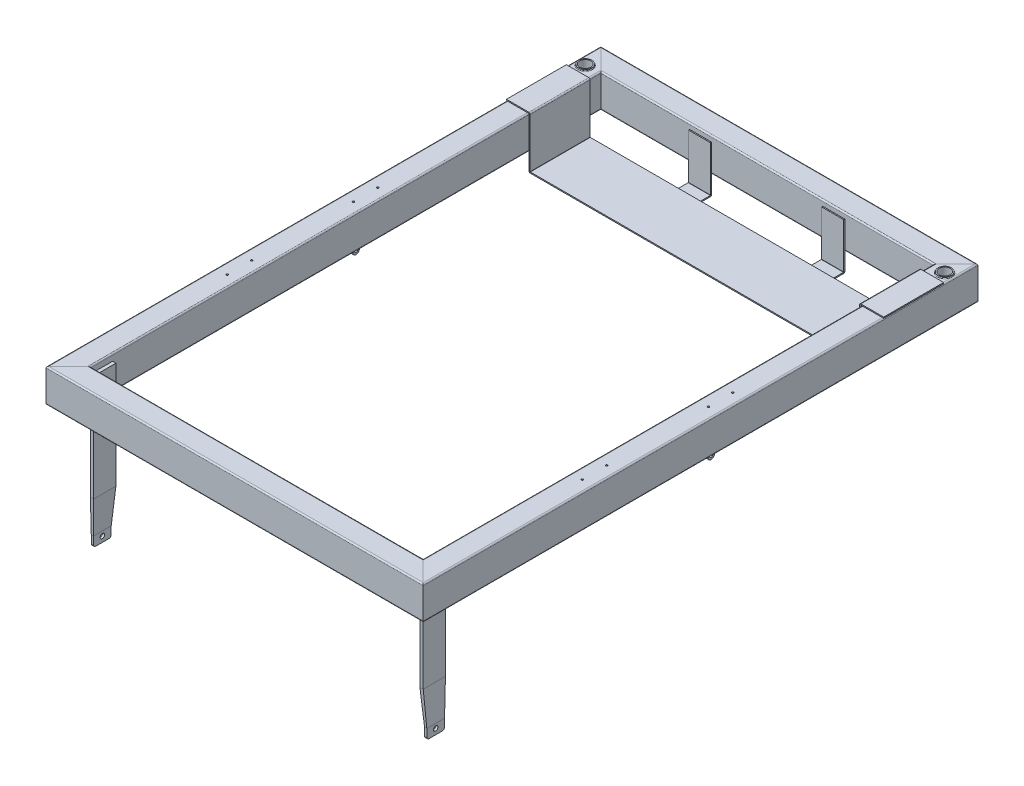
from build123d import *

# Parameters (mm, degrees)
SZKIC9_R                          = 30
WYTNIJ_WYCI_GNI_CIE1_DEPTH        = 2958.617284234
DODANIE_WYCI_GNI_CIE4_DEPTH       = 5
DODANIE_WYCI_GNI_CIE4_DEPTH_BACK  = 155
SZKIC10_R                         = 30
SZKIC10_R_2                       = 25
ZAOKR_GLENIE1_R                   = 3
OTW_R_GWINTOWANY_M101_AT_2_COUNT  = 2
OTW_R_GWINTOWANY_M101_AT_2_PITCH  = 110
OTW_R_GWINTOWANY_M101_AT_3_COUNT  = 2
OTW_R_GWINTOWANY_M101_AT_3_PITCH  = 568.22
OTW_R_GWINTOWANY_M101_AT_4_COUNT  = 2
OTW_R_GWINTOWANY_M101_AT_4_PITCH  = 678.22
SZKIC14_W                         = 20
SZKIC14_H                         = 30
DODANIE_WYCI_GNI_CIE5_DEPTH       = 30
ZAOKR_GLENIE2_RADIUS              = 15
ZAOKR_GLENIE2_LENGTH              = 20
ZAOKR_GLENIE3_RADIUS              = 15
ZAOKR_GLENIE3_LENGTH              = 20
WYTNIJ_WYCI_GNI_CIE2_REACH        = 2975.942
SZKIC15_R                         = 6.5
ZAOKR_GLENIE2_OF_LUSTRO3_2_RADIUS = 15
ZAOKR_GLENIE2_OF_LUSTRO3_2_LENGTH = 20
ZAOKR_GLENIE3_OF_LUSTRO3_2_RADIUS = 15
ZAOKR_GLENIE3_OF_LUSTRO3_2_LENGTH = 20
SZKIC31_W                         = 1700
SZKIC31_H                         = 270
ODGI_CIE_BAZOWE1_DEPTH            = 5
USKOK1_START                      = -2295
USKOK1_DEPTH                      = 270
USKOK1_2_DEPTH                    = 270
USKOK2_START                      = -2295
USKOK2_DEPTH                      = 270
USKOK2_2_DEPTH                    = 270
SZKIC4_W                          = 100
SZKIC4_H                          = 480
DODANIE_WYCI_GNI_CIE2_DEPTH       = 15
SZKIC17_W                         = 10
SZKIC17_H                         = 80
DODANIE_WYCI_GNI_CIE6_DEPTH       = 45
ZAOKR_GLENIE4_R                   = 10
SZKIC16_R                         = 10
WYTNIJ_WYCI_GNI_CIE3_DEPTH        = 10
SZKIC36_W                         = 100
SZKIC36_H                         = 480
ODGI_CIE_BAZOWE2_DEPTH            = 5
SZKIC_START                       = 1050
SZKIC_ZGI_CIA3_DEPTH              = 100
SZKIC_ZGI_CIA3_2_DEPTH            = 100


# Read off the part's stored shape, not the designer's step: Uskok1, Uskok2, Szkic zgięcia3
# Sheet-metal steps are written as plain solids
with BuildPart() as part:
    # Wyciągnięcie po ścieżce1: sweep along a path in Szkic3
    with BuildLine(Plane(origin=(0, 0, 0), x_dir=(1, 0, 0), z_dir=(0, 1, 0))) as wyci_gni_cie_po_cie_ce1_path:
        Line((0, 0), (0, 2400))
        Line((0, 2400), (1600, 2400))
        Line((1600, 2400), (1600, 0))
        Line((1600, 0), (0, 0))
    # Szkic1 → Wyciągnięcie po ścieżce1 (sweep)
    with BuildSketch(Plane.XY):
        with BuildLine():
            Line((-44, 75), (44, 75))
            ThreePointArc((44, 75), (48.242640687, 73.242640687), (50, 69))
            Line((50, 69), (50, -69))
            ThreePointArc((50, -69), (48.242640687, -73.242640687), (44, -75))
            Line((44, -75), (-44, -75))
            ThreePointArc((-44, -75), (-48.242640687, -73.242640687), (-50, -69))
            Line((-50, -69), (-50, 69))
            ThreePointArc((-50, 69), (-48.242640687, 73.242640687), (-44, 75))
        make_face()
        with BuildLine():
            Line((-38, 65), (38, 65))
            ThreePointArc((38, 65), (39.414213562, 64.414213562), (40, 63))
            Line((40, 63), (40, -63))
            ThreePointArc((40, -63), (39.414213562, -64.414213562), (38, -65))
            Line((38, -65), (-38, -65))
            ThreePointArc((-38, -65), (-39.414213562, -64.414213562), (-40, -63))
            Line((-40, -63), (-40, 63))
            ThreePointArc((-40, 63), (-39.414213562, 64.414213562), (-38, 65))
        make_face(mode=Mode.SUBTRACT)
    sweep(path=wyci_gni_cie_po_cie_ce1_path.line, transition=Transition.RIGHT)

    # Szkic9 → Wytnij-wyciągnięcie1 (cut, through all)
    with BuildSketch(Plane(origin=(0, 75, 0), x_dir=(1, 0, 0), z_dir=(0, 1, 0))):
        with Locations(Location((1609.9, 2340, 0), (0, 0, 270))):
            Circle(SZKIC9_R)
        with Locations(Location((-9.9, 2340, 0), (0, 0, 270))):
            Circle(SZKIC9_R)
    extrude(amount=-WYTNIJ_WYCI_GNI_CIE1_DEPTH, mode=Mode.SUBTRACT)

    # Szkic10 → Dodanie-wyciągnięcie4 (add, two sides: drawn at the far end of the back side and taken through both)
    # profile 1 of 2: a face of its own
    with BuildSketch(Plane(origin=(0, 75, 0), x_dir=(1, 0, 0), z_dir=(0, 1, 0)).offset(-DODANIE_WYCI_GNI_CIE4_DEPTH_BACK)):
        with Locations(Location((-9.9, 2340, 0), (0, 0, 180))):
            Circle(SZKIC10_R)
        with Locations(Location((-9.9, 2340, 0), (0, 0, 270))):
            Circle(SZKIC10_R_2, mode=Mode.SUBTRACT)
    # profile 2 of 2: a face of its own
    with BuildSketch(Plane(origin=(0, 75, 0), x_dir=(1, 0, 0), z_dir=(0, 1, 0)).offset(-DODANIE_WYCI_GNI_CIE4_DEPTH_BACK)):
        with Locations(Location((1609.9, 2340, 0), (0, 0, 180))):
            Circle(SZKIC10_R)
        with Locations(Location((1609.9, 2340, 0), (0, 0, 270))):
            Circle(SZKIC10_R_2, mode=Mode.SUBTRACT)
    extrude(amount=DODANIE_WYCI_GNI_CIE4_DEPTH + DODANIE_WYCI_GNI_CIE4_DEPTH_BACK)

    # Zaokrąglenie1
    zaokr_glenie1_edges = [part.edges().sort_by_distance(p)[0] for p in [
        (1639.9, 75, -2340),
        (20.1, 75, -2340),
        (20.1, -75, -2340),
        (1639.9, -75, -2340),
    ]]
    fillet(zaokr_glenie1_edges, radius=ZAOKR_GLENIE1_R)

    # Szkic13 → Otwór gwintowany M101 (revolve, cut)
    with BuildSketch(Plane(origin=(1600, 75, -1395), x_dir=(0, 0, 1), z_dir=(1, 0, 0))):
        Polygon((0, 0), (0, 30.053657631), (4.25, 27.5), (4.25, 0), align=None)
    otw_r_gwintowany_m101 = revolve(axis=Axis((1600, 81.35, -1395), (0, -1, 0)), mode=Mode.SUBTRACT)

    # Otwór gwintowany M101 at 2: Otwór gwintowany M101 ×2
    with Locations(*[(0, 0, i * OTW_R_GWINTOWANY_M101_AT_2_PITCH) for i in range(1, OTW_R_GWINTOWANY_M101_AT_2_COUNT)]):
        add(otw_r_gwintowany_m101, mode=Mode.SUBTRACT)

    # Otwór gwintowany M101 at 3: Otwór gwintowany M101 ×2
    with Locations(*[(0, 0, i * OTW_R_GWINTOWANY_M101_AT_3_PITCH) for i in range(1, OTW_R_GWINTOWANY_M101_AT_3_COUNT)]):
        add(otw_r_gwintowany_m101, mode=Mode.SUBTRACT)

    # Otwór gwintowany M101 at 4: Otwór gwintowany M101 ×2
    with Locations(*[(0, 0, i * OTW_R_GWINTOWANY_M101_AT_4_PITCH) for i in range(1, OTW_R_GWINTOWANY_M101_AT_4_COUNT)]):
        add(otw_r_gwintowany_m101, mode=Mode.SUBTRACT)

    # Lustro2: Otwór gwintowany M101 across plane
    add(otw_r_gwintowany_m101.mirror(Plane.ZY.offset(-800)), mode=Mode.SUBTRACT)

    # Lustro2 copy 1 sketch → Lustro2 copy 1 (revolve, cut)
    with BuildSketch(Plane(origin=(0, 75, -1285), x_dir=(0, 0, 1), z_dir=(-1, 0, 0))):
        Polygon((0, 0), (0, -30.053657631), (4.25, -27.5), (4.25, 0), align=None)
    revolve(axis=Axis((0, 81.35, -1285), (0, 1, 0)), mode=Mode.SUBTRACT)

    # Lustro2 copy 2 sketch → Lustro2 copy 2 (revolve, cut)
    with BuildSketch(Plane(origin=(0, 75, -826.78), x_dir=(0, 0, 1), z_dir=(-1, 0, 0))):
        Polygon((0, 0), (0, -30.053657631), (4.25, -27.5), (4.25, 0), align=None)
    revolve(axis=Axis((0, 81.35, -826.78), (0, 1, 0)), mode=Mode.SUBTRACT)

    # Lustro2 copy 3 sketch → Lustro2 copy 3 (revolve, cut)
    with BuildSketch(Plane(origin=(0, 75, -716.78), x_dir=(0, 0, 1), z_dir=(-1, 0, 0))):
        Polygon((0, 0), (0, -30.053657631), (4.25, -27.5), (4.25, 0), align=None)
    revolve(axis=Axis((0, 81.35, -716.78), (0, 1, 0)), mode=Mode.SUBTRACT)

    # Szkic14 → Dodanie-wyciągnięcie5 (add)
    with BuildSketch(Plane.XZ.offset(75)):
        with Locations((1577.5, -1265)):
            Rectangle(SZKIC14_W, SZKIC14_H)
        with Locations((1622.5, -1265)):
            Rectangle(SZKIC14_W, SZKIC14_H)
    dodanie_wyci_gni_cie5 = extrude(amount=DODANIE_WYCI_GNI_CIE5_DEPTH)

    # Zaokrąglenie2: full round fillet: the end face becomes a half cylinder, R = half its width
    zaokr_glenie2_face = Plane((1622.5, -105, -1265), x_dir=(1, 0, 0), z_dir=(0, -1, 0))  # on the end face: x along it, z out of the body
    zaokr_glenie2_slab = zaokr_glenie2_face.offset(-ZAOKR_GLENIE2_RADIUS / 2) * Box(ZAOKR_GLENIE2_LENGTH, 2 * ZAOKR_GLENIE2_RADIUS, ZAOKR_GLENIE2_RADIUS, mode=Mode.PRIVATE)  # the body's end, R deep
    zaokr_glenie2_round = Plane((1622.5, -90, -1265), x_dir=(0, -1, 0), z_dir=(1, 0, 0)) * Cylinder(ZAOKR_GLENIE2_RADIUS, ZAOKR_GLENIE2_LENGTH, mode=Mode.PRIVATE)  # its axis R under the face
    add(zaokr_glenie2_slab - zaokr_glenie2_round, mode=Mode.SUBTRACT)

    # Zaokrąglenie3: full round fillet: the end face becomes a half cylinder, R = half its width
    zaokr_glenie3_face = Plane((1577.5, -105, -1265), x_dir=(1, 0, 0), z_dir=(0, -1, 0))  # on the end face: x along it, z out of the body
    zaokr_glenie3_slab = zaokr_glenie3_face.offset(-ZAOKR_GLENIE3_RADIUS / 2) * Box(ZAOKR_GLENIE3_LENGTH, 2 * ZAOKR_GLENIE3_RADIUS, ZAOKR_GLENIE3_RADIUS, mode=Mode.PRIVATE)  # the body's end, R deep
    zaokr_glenie3_round = Plane((1577.5, -90, -1265), x_dir=(0, -1, 0), z_dir=(1, 0, 0)) * Cylinder(ZAOKR_GLENIE3_RADIUS, ZAOKR_GLENIE3_LENGTH, mode=Mode.PRIVATE)  # its axis R under the face
    add(zaokr_glenie3_slab - zaokr_glenie3_round, mode=Mode.SUBTRACT)

    # Wytnij-wyciągnięcie2: up to this face of the body (flat: up to its plane)
    wytnij_wyci_gni_cie2_end = Plane(part.part.faces().sort_by_distance((1567.5, -88.599752116, -1265))[0])
    # Szkic15 → Wytnij-wyciągnięcie2 (cut, up to the picked face)
    with BuildSketch(Plane(origin=(1632.5, 0, 0), x_dir=(0, 0, -1), z_dir=(1, 0, 0)), mode=Mode.PRIVATE) as wytnij_wyci_gni_cie2_sk1:
        with Locations(Location((1265, -90, 0), (0, 0, 90))):
            Circle(SZKIC15_R)
    wytnij_wyci_gni_cie2_tool1 = split(extrude(wytnij_wyci_gni_cie2_sk1.sketch, amount=-WYTNIJ_WYCI_GNI_CIE2_REACH, mode=Mode.PRIVATE), bisect_by=wytnij_wyci_gni_cie2_end, keep=Keep.BOTH, mode=Mode.PRIVATE)
    wytnij_wyci_gni_cie2 = wytnij_wyci_gni_cie2_tool1.solids().sort_by(Axis((1632.5, -90, -1265), (-1, 0, 0)))[0]
    add(wytnij_wyci_gni_cie2, mode=Mode.SUBTRACT)

    # Lustro3: Dodanie-wyciągnięcie5, Wytnij-wyciągnięcie2 across plane
    add(dodanie_wyci_gni_cie5.mirror(Plane.ZY.offset(-800)))
    add(wytnij_wyci_gni_cie2.mirror(Plane.ZY.offset(-800)), mode=Mode.SUBTRACT)

    # Zaokrąglenie2 of Lustro3 2: full round fillet: the end face becomes a half cylinder, R = half its width
    zaokr_glenie2_of_lustro3_2_face = Plane((-22.5, -105, -1265), x_dir=(-1, 0, 0), z_dir=(0, -1, 0))  # on the end face: x along it, z out of the body
    zaokr_glenie2_of_lustro3_2_slab = zaokr_glenie2_of_lustro3_2_face.offset(-ZAOKR_GLENIE2_OF_LUSTRO3_2_RADIUS / 2) * Box(ZAOKR_GLENIE2_OF_LUSTRO3_2_LENGTH, 2 * ZAOKR_GLENIE2_OF_LUSTRO3_2_RADIUS, ZAOKR_GLENIE2_OF_LUSTRO3_2_RADIUS, mode=Mode.PRIVATE)  # the body's end, R deep
    zaokr_glenie2_of_lustro3_2_round = Plane((-22.5, -90, -1265), x_dir=(0, -1, 0), z_dir=(-1, 0, 0)) * Cylinder(ZAOKR_GLENIE2_OF_LUSTRO3_2_RADIUS, ZAOKR_GLENIE2_OF_LUSTRO3_2_LENGTH, mode=Mode.PRIVATE)  # its axis R under the face
    add(zaokr_glenie2_of_lustro3_2_slab - zaokr_glenie2_of_lustro3_2_round, mode=Mode.SUBTRACT)

    # Zaokrąglenie3 of Lustro3 2: full round fillet: the end face becomes a half cylinder, R = half its width
    zaokr_glenie3_of_lustro3_2_face = Plane((22.5, -105, -1265), x_dir=(-1, 0, 0), z_dir=(0, -1, 0))  # on the end face: x along it, z out of the body
    zaokr_glenie3_of_lustro3_2_slab = zaokr_glenie3_of_lustro3_2_face.offset(-ZAOKR_GLENIE3_OF_LUSTRO3_2_RADIUS / 2) * Box(ZAOKR_GLENIE3_OF_LUSTRO3_2_LENGTH, 2 * ZAOKR_GLENIE3_OF_LUSTRO3_2_RADIUS, ZAOKR_GLENIE3_OF_LUSTRO3_2_RADIUS, mode=Mode.PRIVATE)  # the body's end, R deep
    zaokr_glenie3_of_lustro3_2_round = Plane((22.5, -90, -1265), x_dir=(0, -1, 0), z_dir=(-1, 0, 0)) * Cylinder(ZAOKR_GLENIE3_OF_LUSTRO3_2_RADIUS, ZAOKR_GLENIE3_OF_LUSTRO3_2_LENGTH, mode=Mode.PRIVATE)  # its axis R under the face
    add(zaokr_glenie3_of_lustro3_2_slab - zaokr_glenie3_of_lustro3_2_round, mode=Mode.SUBTRACT)


with BuildPart() as body_2:
    # Szkic31 → Odgięcie bazowe1 (new body)
    with BuildSketch(Plane(origin=(0, 75, 0), x_dir=(1, 0, 0), z_dir=(0, 1, 0))):
        with Locations((800, 2160)):
            Rectangle(SZKIC31_W, SZKIC31_H)
    extrude(amount=ODGI_CIE_BAZOWE1_DEPTH)

    # Uskok1 outline → Uskok1 (cut)
    with BuildSketch(Plane.XY.offset(USKOK1_START)):
        with BuildLine():
            Line((-50, 75), (1541.852907287, 75))
            ThreePointArc((1541.852907287, 75), (1543.7550024, 78.572353418), (1547.542019696, 80))
            Line((1547.542019696, 80), (-50, 80))
            Line((-50, 80), (-50, 75))
        make_face()
    extrude(amount=USKOK1_DEPTH, mode=Mode.SUBTRACT)

    # Uskok1 2 outline → Uskok1 2 (add)
    with BuildSketch(Plane.XY.offset(USKOK1_START)):
        with BuildLine():
            Line((-50, -150), (-50, -155))
            Line((-50, -155), (1541.068819696, -155))
            ThreePointArc((1541.068819696, -155), (1545.125208457, -153.319788761), (1546.805419696, -149.2634))
            Line((1546.805419696, -149.2634), (1546.805419696, 74.2634))
            ThreePointArc((1546.805419696, 74.2634), (1547.021164841, 74.784254855), (1547.542019696, 75))
            Line((1547.542019696, 75), (1541.852907287, 75))
            ThreePointArc((1541.852907287, 75), (1541.817303904, 74.632464571), (1541.805419696, 74.2634))
            Line((1541.805419696, 74.2634), (1541.805419696, -149.2634))
            ThreePointArc((1541.805419696, -149.2634), (1541.589674551, -149.784254855), (1541.068819696, -150))
            Line((1541.068819696, -150), (-50, -150))
        make_face()
    extrude(amount=USKOK1_2_DEPTH)

    # Uskok2 outline → Uskok2 (cut)
    with BuildSketch(Plane.XY.offset(USKOK2_START)):
        with BuildLine():
            ThreePointArc((57.542019696, -155), (53.7550024, -153.572353418), (51.852907287, -150))
            Line((51.852907287, -150), (-50, -150))
            Line((-50, -150), (-50, -155))
            Line((-50, -155), (57.542019696, -155))
        make_face()
    extrude(amount=USKOK2_DEPTH, mode=Mode.SUBTRACT)

    # Uskok2 2 outline → Uskok2 2 (add)
    with BuildSketch(Plane.XY.offset(USKOK2_START)):
        with BuildLine():
            ThreePointArc((56.805419696, 74.2634), (55.125208457, 78.319788761), (51.068819696, 80))
            Line((51.068819696, 80), (-50, 80))
            Line((-50, 80), (-50, 75))
            Line((-50, 75), (51.068819696, 75))
            ThreePointArc((51.068819696, 75), (51.589674551, 74.784254855), (51.805419696, 74.2634))
            Line((51.805419696, 74.2634), (51.805419696, -149.2634))
            ThreePointArc((51.805419696, -149.2634), (51.817303904, -149.632464571), (51.852907287, -150))
            Line((51.852907287, -150), (57.542019696, -150))
            ThreePointArc((57.542019696, -150), (57.021164841, -149.784254855), (56.805419696, -149.2634))
            Line((56.805419696, -149.2634), (56.805419696, 74.2634))
        make_face()
    extrude(amount=USKOK2_2_DEPTH)


with BuildPart() as body_3:
    # Szkic4 → Dodanie-wyciągnięcie2 (new body)
    with BuildSketch(Plane(origin=(50, 0, 0), x_dir=(0, 0, -1), z_dir=(1, 0, 0))):
        with Locations((100, -195)):
            Rectangle(SZKIC4_W, SZKIC4_H)
    extrude(amount=DODANIE_WYCI_GNI_CIE2_DEPTH)

    # Szkic5 → section 1 of wyci_gni_cie_po_profilach1
    with BuildSketch(Plane(origin=(0, -590, 0), x_dir=(1, 0, 0), z_dir=(0, 1, 0)), mode=Mode.PRIVATE) as wyci_gni_cie_po_profilach1_s1:
        with BuildLine():
            Line((44, 60), (54, 60))
            Line((54, 60), (54, 140))
            Line((54, 140), (44, 140))
            Line((44, 140), (44, 60))
        make_face()
    # loft from a face of the part (wyci_gni_cie_po_profilach1)
    loft([body_3.faces().sort_by_distance((57.5, -435, -100))[0], wyci_gni_cie_po_profilach1_s1.sketch])

    # Szkic17 → Dodanie-wyciągnięcie6 (add)
    with BuildSketch(Plane.XZ.offset(590)):
        with Locations((49, -100)):
            Rectangle(SZKIC17_W, SZKIC17_H)
    extrude(amount=DODANIE_WYCI_GNI_CIE6_DEPTH)

    # Zaokrąglenie4
    zaokr_glenie4_edges = [body_3.edges().sort_by_distance(p)[0] for p in [
        (49, -635, -140),
        (49, -635, -60),
    ]]
    fillet(zaokr_glenie4_edges, radius=ZAOKR_GLENIE4_R)

    # Szkic16 → Wytnij-wyciągnięcie3 (cut)
    with BuildSketch(Plane.ZY.offset(-44)):
        with Locations((-100, -610)):
            Circle(SZKIC16_R)
    extrude(amount=-WYTNIJ_WYCI_GNI_CIE3_DEPTH, mode=Mode.SUBTRACT)


with BuildPart() as body_4:
    # Lustro5: mirrored copy
    add(body_3.part.mirror(Plane.ZY.offset(-800)))


with BuildPart() as body_5:
    # Szkic36 → Odgięcie bazowe2 (new body)
    with BuildSketch(Plane(origin=(0, 0, -2350), x_dir=(-1, 0, 0), z_dir=(0, 0, -1))):
        with Locations((-1100, -190)):
            Rectangle(SZKIC36_W, SZKIC36_H)
    extrude(amount=-ODGI_CIE_BAZOWE2_DEPTH)

    # Szkic zgięcia3 outline → Szkic zgięcia3 (cut)
    with BuildSketch(Plane.YZ.offset(SZKIC_START)):
        with BuildLine():
            ThreePointArc((-154.2634, -2350), (-158.050417296, -2348.572353418), (-159.952512409, -2345))
            Line((-159.952512409, -2345), (-430, -2345))
            Line((-430, -2345), (-430, -2350))
            Line((-430, -2350), (-154.2634, -2350))
        make_face()
    extrude(amount=SZKIC_ZGI_CIA3_DEPTH, mode=Mode.SUBTRACT)

    # Szkic zgi_cia3 2 outline → Szkic zgi_cia3 2 (add)
    with BuildSketch(Plane.YZ.offset(SZKIC_START)):
        with BuildLine():
            Line((-155, -2073.610839391), (-160, -2073.610839391))
            Line((-160, -2073.610839391), (-160, -2344.2634))
            ThreePointArc((-160, -2344.2634), (-159.988115792, -2344.632464571), (-159.952512409, -2345))
            Line((-159.952512409, -2345), (-154.2634, -2345))
            ThreePointArc((-154.2634, -2345), (-154.784254855, -2344.784254855), (-155, -2344.2634))
            Line((-155, -2344.2634), (-155, -2073.610839391))
        make_face()
    extrude(amount=SZKIC_ZGI_CIA3_2_DEPTH)


with BuildPart() as body_6:
    # Lustro6: mirrored copy
    add(body_5.part.mirror(Plane.ZY.offset(-800)))


solid = Compound([part.part, body_2.part, body_3.part, body_4.part, body_5.part, body_6.part])
